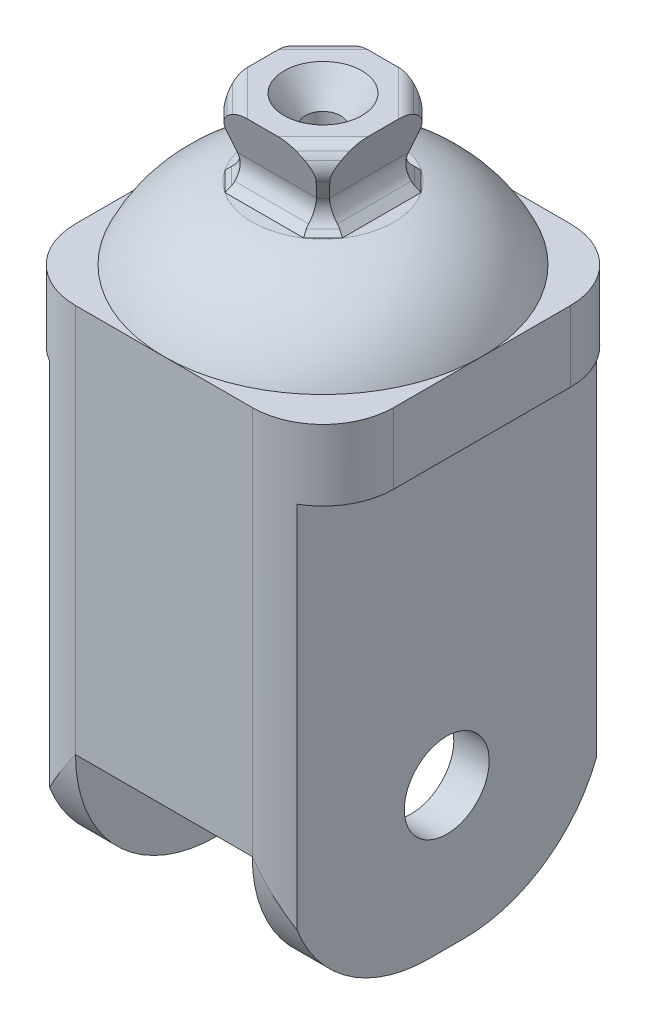
from build123d import *

# Parameters (mm, degrees)
SKETCH4_W           = 17
SKETCH4_H           = 11
BOSS_EXTRUDE2_DEPTH = 8.5
CUT_EXTRUDE1_DEPTH  = 13.5
CUT_EXTRUDE2_DEPTH  = 13.5
CUT_EXTRUDE3_DEPTH  = 13.5
CUT_EXTRUDE4_DEPTH  = 13.5
FILLET1_R           = 2
SKETCH16_W          = 45
SKETCH16_H          = 45
BOSS_EXTRUDE3_DEPTH = 75
SKETCH17_W          = 5
SKETCH17_H          = 65
CUT_EXTRUDE5_DEPTH  = 104.544676
SKETCH18_R          = 6
CUT_EXTRUDE6_DEPTH  = 102.471671
CUT_EXTRUDE7_DEPTH  = 12.5
SKETCH20_R          = 1.5
CUT_EXTRUDE8_DEPTH  = 75
FILLET2_R           = 20
FILLET3_START       = -90.5
FILLET3_DEPTH       = 75


with BuildPart() as part:
    # Sketch4 → Boss-Extrude2 (new, symmetric)
    with BuildSketch(Plane.XY):
        Rectangle(SKETCH4_W, SKETCH4_H)
    extrude(amount=BOSS_EXTRUDE2_DEPTH, both=True)

    # Sketch5 → Cut-Extrude1 (cut, symmetric)
    with BuildSketch(Plane(origin=(0, 0, 0), x_dir=(0, 0, -1), z_dir=(1, 0, 0))):
        with BuildLine():
            Line((8.5, 5.5), (6.50251, -1.291467))
            ThreePointArc((6.50251, -1.291467), (6.473627, -2.879228), (7.259286, -4.259286))
            Line((7.259286, -4.259286), (8.5, -5.5))
            Line((8.5, -5.5), (8.5, 5.5))
        make_face()
        with BuildLine():
            Line((-8.5, -5.5), (-7.259286, -4.259286))
            ThreePointArc((-7.259286, -4.259286), (-6.473627, -2.879228), (-6.50251, -1.291467))
            Line((-6.50251, -1.291467), (-8.5, 5.5))
            Line((-8.5, 5.5), (-8.5, -5.5))
        make_face()
    extrude(amount=CUT_EXTRUDE1_DEPTH, both=True, mode=Mode.SUBTRACT)

    # Sketch7 → Cut-Extrude2 (cut, symmetric)
    with BuildSketch(Plane.XY):
        with BuildLine():
            Line((8.5, 5.5), (6.502538, -1.291517))
            ThreePointArc((6.502538, -1.291517), (6.473662, -2.87927), (7.259319, -4.259319))
            Line((7.259319, -4.259319), (8.5, -5.5))
            Line((8.5, -5.5), (8.5, 5.5))
        make_face()
        with BuildLine():
            Line((-8.5, -5.5), (-7.259319, -4.259319))
            ThreePointArc((-7.259319, -4.259319), (-6.473662, -2.87927), (-6.502538, -1.291517))
            Line((-6.502538, -1.291517), (-8.5, 5.5))
            Line((-8.5, 5.5), (-8.5, -5.5))
        make_face()
    extrude(amount=CUT_EXTRUDE2_DEPTH, both=True, mode=Mode.SUBTRACT)

    # Sketch11 → Cut-Extrude3 (cut, symmetric)
    with BuildSketch(Plane(origin=(0, 0, 0), x_dir=(0.7071067811865509, 0, -0.7071067811865441), z_dir=(0.7071067811865441, 0, 0.7071067811865509))):
        with BuildLine():
            Line((10, -5.5), (9.159523, -4.659523))
            ThreePointArc((9.159523, -4.659523), (8.341069, -3.136307), (8.499292, -1.414383))
            Line((8.499292, -1.414383), (9.693463, 1.541294))
            ThreePointArc((9.693463, 1.541294), (9.908908, 2.799329), (9.581873, 4.033069))
            ThreePointArc((9.581873, 4.033069), (9.013209, 4.854851), (8.25, 5.5))
            Line((8.25, 5.5), (14, 5.5))
            Line((14, 5.5), (14, -5.5))
            Line((14, -5.5), (10, -5.5))
        make_face()
        with BuildLine():
            Line((-14, 5.5), (-8.25, 5.5))
            ThreePointArc((-8.25, 5.5), (-9.013209, 4.854851), (-9.581873, 4.033069))
            ThreePointArc((-9.581873, 4.033069), (-9.908908, 2.799329), (-9.693463, 1.541294))
            Line((-9.693463, 1.541294), (-8.499292, -1.414383))
            ThreePointArc((-8.499292, -1.414383), (-8.341069, -3.136307), (-9.159523, -4.659523))
            Line((-9.159523, -4.659523), (-10, -5.5))
            Line((-10, -5.5), (-14, -5.5))
            Line((-14, -5.5), (-14, 5.5))
        make_face()
    extrude(amount=CUT_EXTRUDE3_DEPTH, both=True, mode=Mode.SUBTRACT)

    # Sketch12 → Cut-Extrude4 (cut, symmetric)
    with BuildSketch(Plane(origin=(0, 0, 0), x_dir=(-0.7071067811865465, 0, -0.7071067811865486), z_dir=(0.7071067811865486, 0, -0.7071067811865465))):
        with BuildLine():
            Line((10, -5.5), (9.159523, -4.659523))
            ThreePointArc((9.159523, -4.659523), (8.341069, -3.136307), (8.499292, -1.414383))
            Line((8.499292, -1.414383), (9.693463, 1.541294))
            ThreePointArc((9.693463, 1.541294), (9.908908, 2.799329), (9.581873, 4.033069))
            ThreePointArc((9.581873, 4.033069), (9.013209, 4.854851), (8.25, 5.5))
            Line((8.25, 5.5), (14, 5.5))
            Line((14, 5.5), (14, -5.5))
            Line((14, -5.5), (10, -5.5))
        make_face()
        with BuildLine():
            Line((-14, 5.5), (-8.25, 5.5))
            ThreePointArc((-8.25, 5.5), (-9.013209, 4.854851), (-9.581873, 4.033069))
            ThreePointArc((-9.581873, 4.033069), (-9.908908, 2.799329), (-9.693463, 1.541294))
            Line((-9.693463, 1.541294), (-8.499292, -1.414383))
            ThreePointArc((-8.499292, -1.414383), (-8.341069, -3.136307), (-9.159523, -4.659523))
            Line((-9.159523, -4.659523), (-10, -5.5))
            Line((-10, -5.5), (-14, -5.5))
            Line((-14, -5.5), (-14, 5.5))
        make_face()
    extrude(amount=CUT_EXTRUDE4_DEPTH, both=True, mode=Mode.SUBTRACT)

    # Sketch14 → Cut-Revolve1 (revolve, cut)
    with BuildSketch(Plane.XY, mode=Mode.PRIVATE) as cut_revolve1_sk:
        Polygon((0, 5.5), (5.5, 5.5), (2.5, 1.5), (2.5, -5.5), (0, -5.5), align=None)
    revolve(cut_revolve1_sk.sketch.rotate(Axis((0, -5.5, 0), (0, 1, 0)), 90), axis=Axis((0, -5.5, 0), (0, 1, 0)), mode=Mode.SUBTRACT)

    # Fillet1
    fillet1_edges = [part.edges().sort_by_distance(p)[0] for p in [
        (5.833631, 5.5, -5.833631),
        (-5.833631, 5.5, -5.833631),
        (-5.833631, 5.5, 5.833631),
        (5.833631, 5.5, 5.833631),
    ]]
    fillet(fillet1_edges, radius=FILLET1_R)

    # Sketch15 → Revolve1 (revolve)
    with BuildSketch(Plane(origin=(0, 0, 0), x_dir=(0, 0, -1), z_dir=(1, 0, 0))):
        with BuildLine():
            Line((0, -15.5), (22.5, -15.5))
            ThreePointArc((22.5, -15.5), (17.455905, -8.920713), (9.998, -5.3))
            Line((9.998, -5.3), (0, -5.3))
            Line((0, -5.3), (0, -5.5))
            Line((0, -5.5), (0, -15.5))
        make_face()
    revolve(axis=Axis((0, -5.5, 0), (0, -1, 0)))

    # Sketch16 → Boss-Extrude3 (add)
    with BuildSketch(Plane.XZ.offset(15.5)):
        Rectangle(SKETCH16_W, SKETCH16_H)
    extrude(amount=BOSS_EXTRUDE3_DEPTH)

    # Sketch17 → Cut-Extrude5 (cut, through all)
    with BuildSketch(Plane.XY.offset(22.5)):
        with Locations((-20, -58)):
            Rectangle(SKETCH17_W, SKETCH17_H)
        with Locations((20, -58)):
            Rectangle(SKETCH17_W, SKETCH17_H)
    extrude(amount=-CUT_EXTRUDE5_DEPTH, mode=Mode.SUBTRACT)

    # Sketch18 → Cut-Extrude6 (cut, through all)
    with BuildSketch(Plane(origin=(17.5, 0, 0), x_dir=(0, 0, -1), z_dir=(1, 0, 0))):
        with Locations(Location((0, -70.5, 0), (0, 0, 90))):
            Circle(SKETCH18_R)
    extrude(amount=-CUT_EXTRUDE6_DEPTH, mode=Mode.SUBTRACT)

    # Sketch19 → Cut-Extrude7 (cut, symmetric)
    with BuildSketch(Plane(origin=(0, 0, 0), x_dir=(0, 0, -1), z_dir=(1, 0, 0))):
        with BuildLine():
            Line((-22.5, -90.5), (-22.5, -70.5))
            Line((-22.5, -70.5), (-12.5, -70.5))
            ThreePointArc((-12.5, -70.5), (-2.971074, -58.358224), (11.087635, -64.728142))
            Line((11.087635, -64.728142), (22.5, -58.787241))
            Line((22.5, -58.787241), (22.5, -90.5))
            Line((22.5, -90.5), (-22.5, -90.5))
        make_face()
    extrude(amount=CUT_EXTRUDE7_DEPTH, both=True, mode=Mode.SUBTRACT)

    # Sketch20 → Cut-Extrude8 (cut)
    with BuildSketch(Plane.XZ.offset(90.5)):
        with Locations(Location((-10.5, 10.5, 0), (0, 0, 270))):
            Circle(SKETCH20_R)
    extrude(amount=-CUT_EXTRUDE8_DEPTH, mode=Mode.SUBTRACT)

    # Fillet2
    fillet2_edges = [part.edges().sort_by_distance(p)[0] for p in [
        (-15, -90.5, -22.5),
        (15, -90.5, -22.5),
        (-15, -90.5, 22.5),
        (15, -90.5, 22.5),
    ]]
    fillet(fillet2_edges, radius=FILLET2_R)

    # Fillet3: read off the stored shape, not the designer's step
    # Fillet3 outline → Fillet3 (cut)
    with BuildSketch(Plane(origin=(0, 0, 0), x_dir=(1, 0, 0), z_dir=(0, 1, 0)).offset(FILLET3_START)):
        with BuildLine():
            ThreePointArc((22.5, -12.5), (19.571068, -19.571068), (12.5, -22.5))
            Line((12.5, -22.5), (22.5, -22.5))
            Line((22.5, -22.5), (22.5, -12.5))
        make_face()
        with BuildLine():
            Line((-22.5, -22.5), (-12.5, -22.5))
            ThreePointArc((-12.5, -22.5), (-19.571068, -19.571068), (-22.5, -12.5))
            Line((-22.5, -12.5), (-22.5, -22.5))
        make_face()
        with BuildLine():
            ThreePointArc((12.5, 22.5), (19.571068, 19.571068), (22.5, 12.5))
            Line((22.5, 12.5), (22.5, 22.5))
            Line((22.5, 22.5), (12.5, 22.5))
        make_face()
        with BuildLine():
            Line((-22.5, 22.5), (-22.5, 12.5))
            ThreePointArc((-22.5, 12.5), (-19.571068, 19.571068), (-12.5, 22.5))
            Line((-12.5, 22.5), (-22.5, 22.5))
        make_face()
    extrude(amount=FILLET3_DEPTH, mode=Mode.SUBTRACT)


solid = part.part
